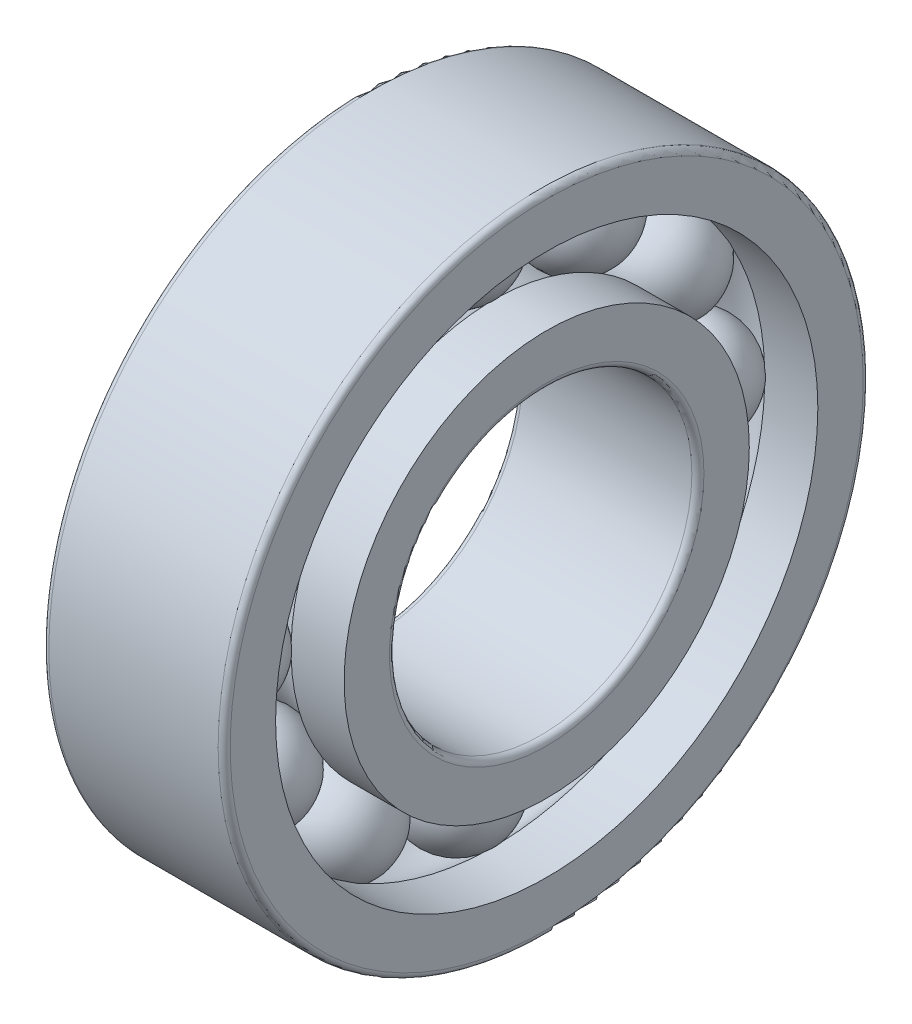
from build123d import *

# Parameters (mm, degrees)
CAGSPISKE_W         = 0.51
CAGSPISKE_H         = 0.85
CAGESPINE_ANGLE     = 0.001
BALLSDETAILED_COUNT = 12
BALLSDETAILED_ANGLE = 330


with BuildPart() as part:
    # CagSpiSke → CageSpine (revolve)
    with BuildSketch(Plane.XY):
        with Locations((0, 11.75)):
            Rectangle(CAGSPISKE_W, CAGSPISKE_H)
    revolve(axis=Axis((-20.6375, 0, 0), (-1, 0, 0)), revolution_arc=CAGESPINE_ANGLE)

    # BalDetSke → BallDetailed (revolve)
    with BuildSketch(Plane.XY):
        with BuildLine():
            Line((-2.55, 11.75), (2.55, 11.75))
            ThreePointArc((2.55, 11.75), (0, 9.2), (-2.55, 11.75))
        make_face()
    balldetailed = revolve(axis=Axis((-1.905, 11.75, 0), (1, 0, 0)))

    # InnRacSke → InnerRace (revolve)
    with BuildSketch(Plane.XY):
        with BuildLine():
            Line((-1.86698286, 10.05), (-4.5, 10.05))
            Line((-4.5, 10.05), (-4.5, 7.8))
            ThreePointArc((-4.5, 7.8), (-4.412132034, 7.587867966), (-4.2, 7.5))
            Line((-4.2, 7.5), (4.2, 7.5))
            ThreePointArc((4.2, 7.5), (4.412132034, 7.587867966), (4.5, 7.8))
            Line((4.5, 7.8), (4.5, 10.05))
            Line((4.5, 10.05), (1.86698286, 10.05))
            ThreePointArc((1.86698286, 10.05), (0, 9.225), (-1.86698286, 10.05))
        make_face()
    revolve(axis=Axis((-20.6375, 0, 0), (1, 0, 0)))

    # OutRacSke → OuterRace (revolve)
    with BuildSketch(Plane.XY):
        with BuildLine():
            Line((-1.86698286, 13.45), (-4.5, 13.45))
            Line((-4.5, 13.45), (-4.5, 15.7))
            ThreePointArc((-4.5, 15.7), (-4.412132034, 15.912132034), (-4.2, 16))
            Line((-4.2, 16), (4.2, 16))
            ThreePointArc((4.2, 16), (4.412132034, 15.912132034), (4.5, 15.7))
            Line((4.5, 15.7), (4.5, 13.45))
            Line((4.5, 13.45), (1.86698286, 13.45))
            ThreePointArc((1.86698286, 13.45), (0, 14.275), (-1.86698286, 13.45))
        make_face()
    revolve(axis=Axis((-20.6375, 0, 0), (1, 0, 0)))

    # BallsDetailed: BallDetailed ×12 about axis
    ballsdetailed_axis = Axis((-50, 0, 0), (1, 0, 0))
    for i in range(1, BALLSDETAILED_COUNT):
        add(balldetailed.rotate(ballsdetailed_axis, i * BALLSDETAILED_ANGLE / (BALLSDETAILED_COUNT - 1)))


solid = part.part
